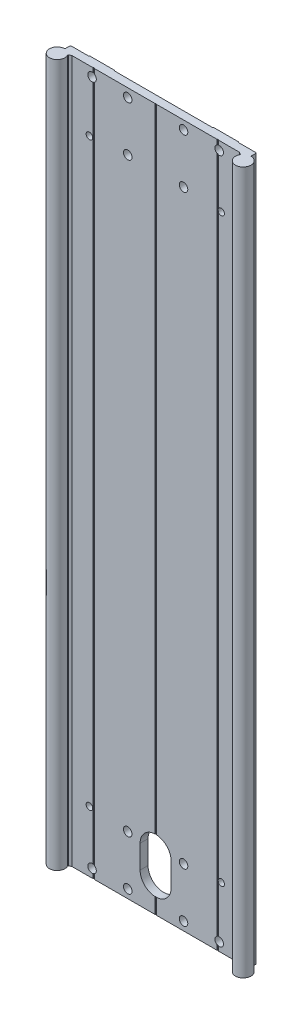
from build123d import *

# Parameters (mm, degrees)
BOSS_EXTRUDE1_DEPTH      = 253
BOSS_EXTRUDE1_DEPTH_BACK = 200
SKETCH2_R                = 2.75
CUT_EXTRUDE1_DEPTH       = 458.853688421
SKETCH3_R                = 2.1
CUT_EXTRUDE2_DEPTH       = 458.853688421
CUT_EXTRUDE3_DEPTH       = 458.841632009


# Read off the part's stored shape, not the designer's step: Imported1
with BuildPart() as part:
    # Sketch1 → Boss-Extrude1 (new, two sides: drawn at the far end of the back side and taken through both)
    with BuildSketch(Plane(origin=(0, 200, 0), x_dir=(1, 0, 0), z_dir=(0, 1, 0)).offset(-BOSS_EXTRUDE1_DEPTH_BACK)):
        with BuildLine():
            Line((0, -5.21132487), (0.5, -5.5))
            Line((0.5, -5.5), (39.5, -5.5))
            Line((39.5, -5.5), (40, -5.21132487))
            Line((40, -5.21132487), (40.5, -5.5))
            Line((40.5, -5.5), (54, -5.5))
            Line((54, -5.5), (55.431521652, -6.326489411))
            ThreePointArc((55.431521652, -6.326489411), (55.569235651, -6.501322592), (55.548605331, -6.722921727))
            ThreePointArc((55.548605331, -6.722921727), (62.487270984, -13.337451224), (60.283018873, -4.0080164))
            ThreePointArc((60.283018873, -4.0080164), (60.081946867, -3.914538227), (60, -3.708497377))
            Line((60, -3.708497377), (60, -0.9))
            Line((60, -0.9), (59.5, -0.4))
            Line((59.5, -0.4), (48.4, -0.4))
            Line((48.4, -0.4), (48, 0))
            Line((48, 0), (32, 0))
            Line((32, 0), (31.6, -0.4))
            Line((31.6, -0.4), (-31.6, -0.4))
            Line((-31.6, -0.4), (-32, 0))
            Line((-32, 0), (-48, 0))
            Line((-48, 0), (-48.4, -0.4))
            Line((-48.4, -0.4), (-59.5, -0.4))
            Line((-59.5, -0.4), (-60, -0.9))
            Line((-60, -0.9), (-60, -3.708497387))
            ThreePointArc((-60, -3.708497387), (-60.081946862, -3.914538232), (-60.283018865, -4.0080164))
            ThreePointArc((-60.283018865, -4.0080164), (-62.487270987, -13.337451222), (-55.548605331, -6.722921727))
            ThreePointArc((-55.548605331, -6.722921727), (-55.569235651, -6.501322592), (-55.431521652, -6.326489411))
            Line((-55.431521652, -6.326489411), (-54, -5.5))
            Line((-54, -5.5), (-40.5, -5.5))
            Line((-40.5, -5.5), (-40, -5.21132487))
            Line((-40, -5.21132487), (-39.5, -5.5))
            Line((-39.5, -5.5), (-0.5, -5.5))
            Line((-0.5, -5.5), (0, -5.21132487))
        make_face()
    extrude(amount=BOSS_EXTRUDE1_DEPTH + BOSS_EXTRUDE1_DEPTH_BACK)

    # Sketch2 → Cut-Extrude1 (cut, through all)
    with BuildSketch(Plane(origin=(0, 0, 0), x_dir=(-1, 0, 0), z_dir=(0, 0, -1))):
        with Locations((-18, 415.5)):
            Circle(SKETCH2_R)
        with Locations((18, 415.5)):
            Circle(SKETCH2_R)
        with Locations((-18, 37.5)):
            Circle(SKETCH2_R)
        with Locations((18, 37.5)):
            Circle(SKETCH2_R)
        with Locations((-41, 447.5)):
            Circle(SKETCH2_R)
        with Locations((-18, 447.5)):
            Circle(SKETCH2_R)
        with Locations((18, 447.5)):
            Circle(SKETCH2_R)
        with Locations((41, 447.5)):
            Circle(SKETCH2_R)
        with Locations(Location((-41, 5.5, 0), (0, 0, 303.055731151))):
            Circle(SKETCH2_R)
        with Locations((-18, 5.5)):
            Circle(SKETCH2_R)
        with Locations((18, 5.5)):
            Circle(SKETCH2_R)
        with Locations(Location((41, 5.5, 0), (0, 0, 100.475681696))):
            Circle(SKETCH2_R)
    extrude(amount=-CUT_EXTRUDE1_DEPTH, mode=Mode.SUBTRACT)

    # Sketch3 → Cut-Extrude2 (cut, through all)
    with BuildSketch(Plane(origin=(0, 0, 0), x_dir=(-1, 0, 0), z_dir=(0, 0, -1))):
        with Locations((-42.3, 413.77)):
            Circle(SKETCH3_R)
        with Locations((42.7, 413.77)):
            Circle(SKETCH3_R)
        with Locations(Location((-42.3, 39.23, 0), (0, 0, 31.002719134))):
            Circle(SKETCH3_R)
        with Locations((42.7, 39.23)):
            Circle(SKETCH3_R)
    extrude(amount=-CUT_EXTRUDE2_DEPTH, mode=Mode.SUBTRACT)

    # Sketch4 → Cut-Extrude3 (cut, through all)
    with BuildSketch(Plane(origin=(0, 0, 0.4), x_dir=(-1, 0, 0), z_dir=(0, 0, -1))):
        with BuildLine():
            Line((10, 35), (10, 20))
            ThreePointArc((10, 20), (0, 10), (-10, 20))
            Line((-10, 20), (-10, 35))
            ThreePointArc((-10, 35), (0, 45), (10, 35))
        make_face()
    extrude(amount=-CUT_EXTRUDE3_DEPTH, mode=Mode.SUBTRACT)


solid = part.part
